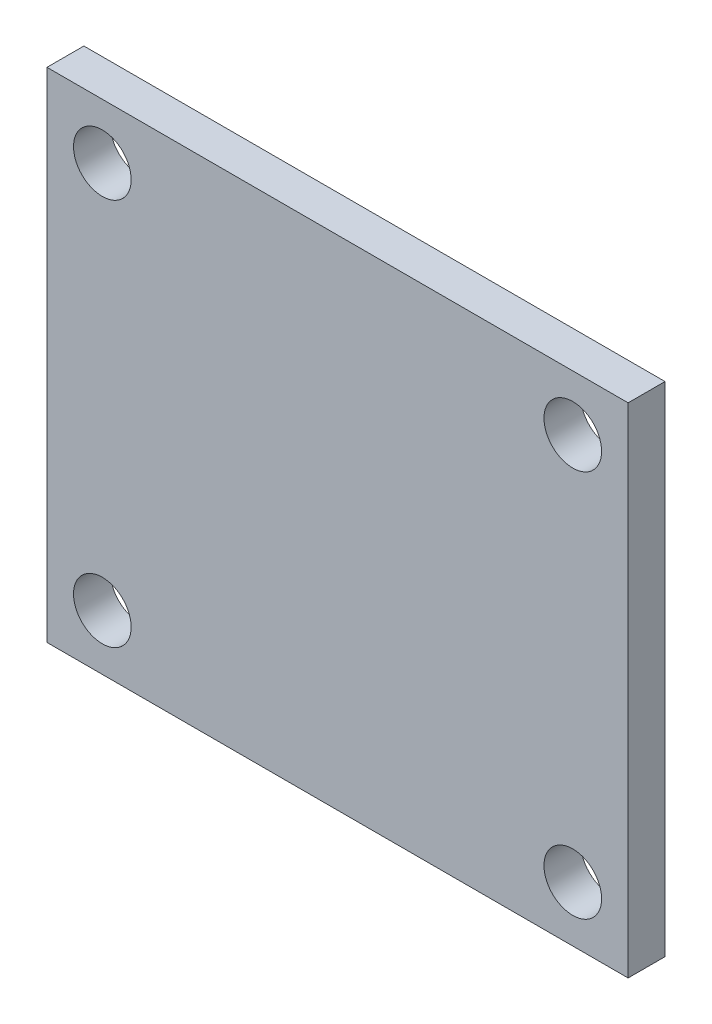
from build123d import *

# Parameters (mm, degrees)
SKETCH1_W           = 31.5
SKETCH1_H           = 27
SKETCH1_R           = 1.5625
BOSS_EXTRUDE1_DEPTH = 2
SKETCH1_3_W         = 12
SKETCH1_3_H         = 8
BOSS_EXTRUDE2_DEPTH = 1


with BuildPart() as part:
    # Sketch1 → Boss-Extrude1 (new body)
    with BuildSketch(Plane.XY):
        Rectangle(SKETCH1_W, SKETCH1_H)
        with Locations((-12.75, -10.5)):
            Circle(SKETCH1_R, mode=Mode.SUBTRACT)
        with Locations((12.75, -10.5)):
            Circle(SKETCH1_R, mode=Mode.SUBTRACT)
        with Locations((-12.75, 10.5)):
            Circle(SKETCH1_R, mode=Mode.SUBTRACT)
        with Locations((12.75, 10.5)):
            Circle(SKETCH1_R, mode=Mode.SUBTRACT)
    extrude(amount=BOSS_EXTRUDE1_DEPTH)

    # Sketch1<3> → Boss-Extrude2 (add)
    with BuildSketch(Plane.XY):
        Rectangle(SKETCH1_3_W, SKETCH1_3_H)
    extrude(amount=-BOSS_EXTRUDE2_DEPTH)


solid = part.part
